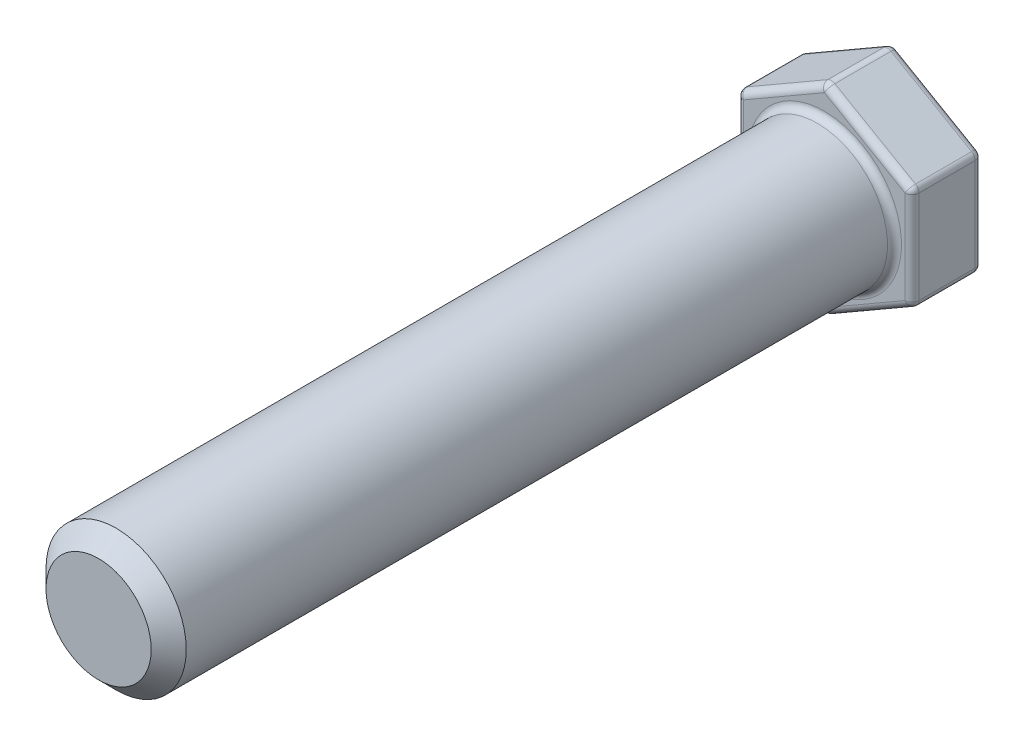
from build123d import *

# Parameters (mm, degrees)
SKETCH1_R           = 2
BOSS_EXTRUDE1_DEPTH = 20.7
BOSS_EXTRUDE2_DEPTH = 2
FILLET1_R           = 0.2
FILLET2_R           = 0.2
CHAMFER1_SIZE       = 0.5


with BuildPart() as part:
    # Sketch1 → Boss-Extrude1 (new body)
    with BuildSketch(Plane.XY):
        Circle(SKETCH1_R)
    extrude(amount=BOSS_EXTRUDE1_DEPTH)

    # Sketch2 → Boss-Extrude2 (add)
    with BuildSketch(Plane(origin=(0, 0, 0), x_dir=(-1, 0, 0), z_dir=(0, 0, -1))):
        Polygon((-2.5, 1.443375673), (-2.5, -1.443375673), (0, -2.886751346), (2.5, -1.443375673), (2.5, 1.443375673), (0, 2.886751346), align=None)
    extrude(amount=BOSS_EXTRUDE2_DEPTH)

    # Fillet1
    fillet1_edges = [part.edges().sort_by_distance(p)[0] for p in [
        (-1.25, 2.165063509, -2),
        (-2.5, 0, -2),
        (-1.25, -2.165063509, -2),
        (1.25, -2.165063509, -2),
        (2.5, 0, -2),
        (1.25, 2.165063509, -2),
        (2.5, 0, 0),
        (1.25, -2.165063509, 0),
        (-1.25, -2.165063509, 0),
        (-2.5, 0, 0),
        (-1.25, 2.165063509, 0),
        (1.25, 2.165063509, 0),
        (-2, 0, 0),
    ]]
    fillet(fillet1_edges, radius=FILLET1_R)

    # Fillet2
    fillet2_edges = [part.edges().sort_by_distance(p)[0] for p in [
        (0, 2.813180543, -1.94637683),
        (0, 2.813180543, -0.05362317),
        (-2.436285816, 1.406590271, -1.94637683),
        (-2.436285816, 1.406590271, -0.05362317),
        (-2.436285816, -1.406590271, -1.94637683),
        (-2.436285816, -1.406590271, -0.05362317),
        (0, -2.813180543, -1.94637683),
        (0, -2.813180543, -0.05362317),
        (2.436285816, -1.406590271, -1.94637683),
        (2.436285816, -1.406590271, -0.05362317),
        (2.436285816, 1.406590271, -1.94637683),
        (2.436285816, 1.406590271, -0.05362317),
        (0, 2.886751346, -1),
        (-2.5, 1.443375673, -1),
        (-2.5, -1.443375673, -1),
        (0, -2.886751346, -1),
        (2.5, -1.443375673, -1),
        (2.5, 1.443375673, -1),
    ]]
    fillet(fillet2_edges, radius=FILLET2_R)

    # Chamfer1
    chamfer1_edges = [part.edges().sort_by_distance(p)[0] for p in [
        (-2, 0, 20.7),
    ]]
    chamfer(chamfer1_edges, length=CHAMFER1_SIZE)


solid = part.part
